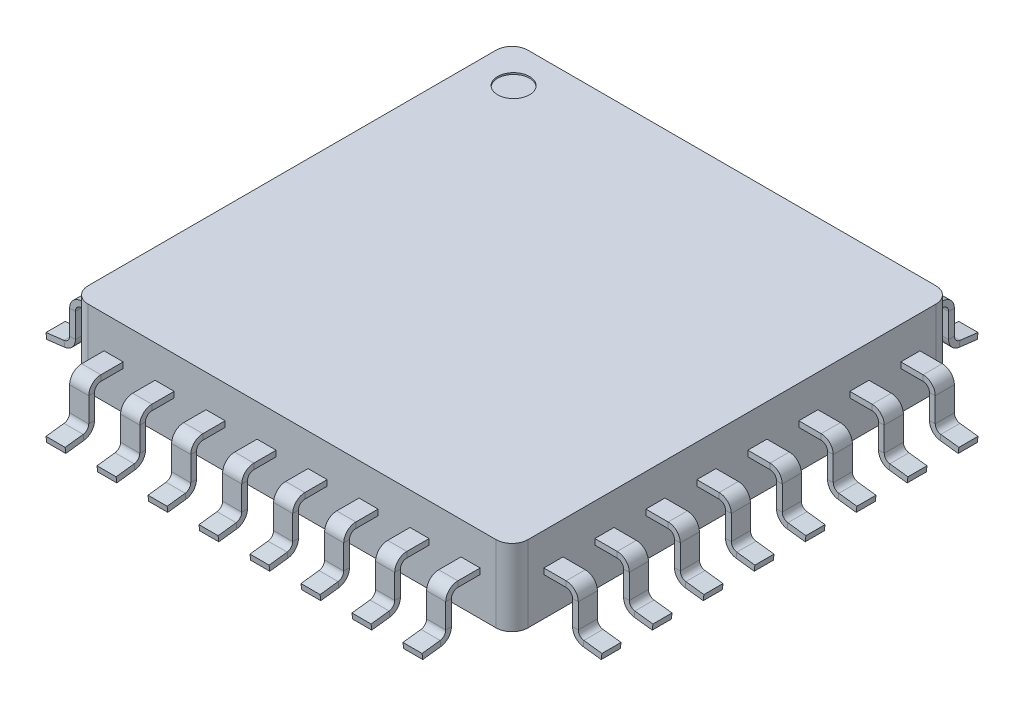
from build123d import *

# Parameters (mm, degrees)
SKETCH1_W               = 6.9
SKETCH1_H               = 6.9
BOSS_EXTRUDE1_DEPTH     = 1.2
FILLET1_R               = 0.25
SKETCH2_R               = 0.25
CUT_EXTRUDE1_DEPTH      = 0.025
BASE_FLANGE1_DEPTH      = 0.15
BASE_FLANGE1_DEPTH_BACK = 0.15
LPATTERN1_COUNT         = 5
LPATTERN1_PITCH         = 0.8
LPATTERN1_2_COUNT       = 4
LPATTERN1_2_PITCH       = 0.8
BASE_FLANGE2_START      = -0.15
BASE_FLANGE2_DEPTH      = 0.3
LPATTERN2_COUNT         = 5
LPATTERN2_PITCH         = 0.8
LPATTERN2_2_COUNT       = 4
LPATTERN2_2_PITCH       = 0.8


# Read off the part's stored shape, not the designer's step: Base-Flange2
# Sheet-metal steps are written as plain solids
with BuildPart() as part:
    # Sketch1 → Boss-Extrude1 (new body)
    with BuildSketch(Plane(origin=(0, 0, 0), x_dir=(1, 0, 0), z_dir=(0, 1, 0))):
        Rectangle(SKETCH1_W, SKETCH1_H)
    extrude(amount=BOSS_EXTRUDE1_DEPTH)

    # Fillet1
    fillet1_edges = [part.edges().sort_by_distance(p)[0] for p in [
        (3.45, 0.6, 3.45),
        (-3.45, 0.6, 3.45),
        (-3.45, 0.6, -3.45),
        (3.45, 0.6, -3.45),
    ]]
    fillet(fillet1_edges, radius=FILLET1_R)

    # Sketch2 → Cut-Extrude1 (cut)
    with BuildSketch(Plane(origin=(0, 1.2, 0), x_dir=(1, 0, 0), z_dir=(0, 1, 0))):
        with Locations(Location((-2.830868185, 2.855763462, 0), (0, 0, 270))):
            Circle(SKETCH2_R)
    extrude(amount=-CUT_EXTRUDE1_DEPTH, mode=Mode.SUBTRACT)


with BuildPart() as body_2:
    # Sketch3 → Base-Flange1 (new, two sides: drawn at the far end of the back side and taken through both)
    with BuildSketch(Plane.XY.offset(-0.4).offset(-BASE_FLANGE1_DEPTH_BACK)):
        with BuildLine():
            Line((-3.45, 0.6), (-3.8, 0.6))
            ThreePointArc((-3.8, 0.6), (-3.870710678, 0.570710678), (-3.9, 0.5))
            Line((-3.9, 0.5), (-3.9, 0.1180978))
            ThreePointArc((-3.9, 0.1180978), (-3.947698413, -0.007800009), (-4.066844825, -0.070485969))
            Line((-4.066844825, -0.070485969), (-4.35, -0.105253052))
            Line((-4.35, -0.105253052), (-4.360968241, -0.015923899))
            Line((-4.360968241, -0.015923899), (-4.077813066, 0.018843185))
            ThreePointArc((-4.077813066, 0.018843185), (-4.015104428, 0.051835795), (-3.99, 0.1180978))
            Line((-3.99, 0.1180978), (-3.99, 0.5))
            ThreePointArc((-3.99, 0.5), (-3.934350288, 0.634350288), (-3.8, 0.69))
            Line((-3.8, 0.69), (-3.45, 0.69))
            Line((-3.45, 0.69), (-3.45, 0.6))
        make_face()
    extrude(amount=BASE_FLANGE1_DEPTH + BASE_FLANGE1_DEPTH_BACK)


with BuildPart() as lpattern1_1:
    # LPattern1: pattern copy
    add(body_2.part.moved(Location(Vector(0, 0, 1) * (1 * LPATTERN1_PITCH))))


with BuildPart() as lpattern1_2:
    # LPattern1: pattern copy
    add(body_2.part.moved(Location(Vector(0, 0, 1) * (2 * LPATTERN1_PITCH))))


with BuildPart() as lpattern1_3:
    # LPattern1: pattern copy
    add(body_2.part.moved(Location(Vector(0, 0, 1) * (3 * LPATTERN1_PITCH))))


with BuildPart() as lpattern1_4:
    # LPattern1: pattern copy
    add(body_2.part.moved(Location(Vector(0, 0, 1) * (4 * LPATTERN1_PITCH))))


with BuildPart() as lpattern1_2_1:
    # LPattern1 2: pattern copy
    add(body_2.part.moved(Location(Vector(0, 0, -1) * (1 * LPATTERN1_2_PITCH))))


with BuildPart() as lpattern1_2_2:
    # LPattern1 2: pattern copy
    add(body_2.part.moved(Location(Vector(0, 0, -1) * (2 * LPATTERN1_2_PITCH))))


with BuildPart() as lpattern1_2_3:
    # LPattern1 2: pattern copy
    add(body_2.part.moved(Location(Vector(0, 0, -1) * (3 * LPATTERN1_2_PITCH))))


with BuildPart() as body_10:
    # Mirror1: mirrored copy
    add(body_2.part.mirror(Plane.ZY))


with BuildPart() as body_11:
    # Mirror1 2: mirrored copy
    add(lpattern1_1.part.mirror(Plane.ZY))


with BuildPart() as body_12:
    # Mirror1 3: mirrored copy
    add(lpattern1_2.part.mirror(Plane.ZY))


with BuildPart() as body_13:
    # Mirror1 4: mirrored copy
    add(lpattern1_3.part.mirror(Plane.ZY))


with BuildPart() as body_14:
    # Mirror1 5: mirrored copy
    add(lpattern1_4.part.mirror(Plane.ZY))


with BuildPart() as body_15:
    # Mirror1 6: mirrored copy
    add(lpattern1_2_1.part.mirror(Plane.ZY))


with BuildPart() as body_16:
    # Mirror1 7: mirrored copy
    add(lpattern1_2_2.part.mirror(Plane.ZY))


with BuildPart() as body_17:
    # Mirror1 8: mirrored copy
    add(lpattern1_2_3.part.mirror(Plane.ZY))


with BuildPart() as body_18:
    # Base-Flange2 outline → Base-Flange2 (new body)
    with BuildSketch(Plane.ZY.offset(-0.4).offset(BASE_FLANGE2_START)):
        with BuildLine():
            Line((-4.077813066, 0.018843185), (-4.360968241, -0.015923899))
            Line((-4.360968241, -0.015923899), (-4.35, -0.105253052))
            Line((-4.35, -0.105253052), (-4.066844825, -0.070485969))
            ThreePointArc((-4.066844825, -0.070485969), (-3.947698413, -0.007800009), (-3.9, 0.1180978))
            Line((-3.9, 0.1180978), (-3.9, 0.5))
            ThreePointArc((-3.9, 0.5), (-3.870710678, 0.570710678), (-3.8, 0.6))
            Line((-3.8, 0.6), (-3.45, 0.6))
            Line((-3.45, 0.6), (-3.45, 0.69))
            Line((-3.45, 0.69), (-3.8, 0.69))
            ThreePointArc((-3.8, 0.69), (-3.934350288, 0.634350288), (-3.99, 0.5))
            Line((-3.99, 0.5), (-3.99, 0.1180978))
            ThreePointArc((-3.99, 0.1180978), (-4.015104428, 0.051835795), (-4.077813066, 0.018843185))
        make_face()
    extrude(amount=BASE_FLANGE2_DEPTH)


with BuildPart() as lpattern2_1:
    # LPattern2: pattern copy
    add(body_18.part.moved(Location(Vector(-1, 0, 0) * (1 * LPATTERN2_PITCH))))


with BuildPart() as lpattern2_2:
    # LPattern2: pattern copy
    add(body_18.part.moved(Location(Vector(-1, 0, 0) * (2 * LPATTERN2_PITCH))))


with BuildPart() as lpattern2_3:
    # LPattern2: pattern copy
    add(body_18.part.moved(Location(Vector(-1, 0, 0) * (3 * LPATTERN2_PITCH))))


with BuildPart() as lpattern2_4:
    # LPattern2: pattern copy
    add(body_18.part.moved(Location(Vector(-1, 0, 0) * (4 * LPATTERN2_PITCH))))


with BuildPart() as lpattern2_2_1:
    # LPattern2 2: pattern copy
    add(body_18.part.moved(Location(Vector(1, 0, 0) * (1 * LPATTERN2_2_PITCH))))


with BuildPart() as lpattern2_2_2:
    # LPattern2 2: pattern copy
    add(body_18.part.moved(Location(Vector(1, 0, 0) * (2 * LPATTERN2_2_PITCH))))


with BuildPart() as lpattern2_2_3:
    # LPattern2 2: pattern copy
    add(body_18.part.moved(Location(Vector(1, 0, 0) * (3 * LPATTERN2_2_PITCH))))


with BuildPart() as body_26:
    # Mirror2: mirrored copy
    add(body_18.part.mirror(Plane.XY))


with BuildPart() as body_27:
    # Mirror2 2: mirrored copy
    add(lpattern2_2_1.part.mirror(Plane.XY))


with BuildPart() as body_28:
    # Mirror2 3: mirrored copy
    add(lpattern2_2_2.part.mirror(Plane.XY))


with BuildPart() as body_29:
    # Mirror2 4: mirrored copy
    add(lpattern2_2_3.part.mirror(Plane.XY))


with BuildPart() as body_30:
    # Mirror2 5: mirrored copy
    add(lpattern2_1.part.mirror(Plane.XY))


with BuildPart() as body_31:
    # Mirror2 6: mirrored copy
    add(lpattern2_2.part.mirror(Plane.XY))


with BuildPart() as body_32:
    # Mirror2 7: mirrored copy
    add(lpattern2_3.part.mirror(Plane.XY))


with BuildPart() as body_33:
    # Mirror2 8: mirrored copy
    add(lpattern2_4.part.mirror(Plane.XY))


solid = Compound([part.part, body_2.part, lpattern1_1.part, lpattern1_2.part, lpattern1_3.part, lpattern1_4.part, lpattern1_2_1.part, lpattern1_2_2.part, lpattern1_2_3.part, body_10.part, body_11.part, body_12.part, body_13.part, body_14.part, body_15.part, body_16.part, body_17.part, body_18.part, lpattern2_1.part, lpattern2_2.part, lpattern2_3.part, lpattern2_4.part, lpattern2_2_1.part, lpattern2_2_2.part, lpattern2_2_3.part, body_26.part, body_27.part, body_28.part, body_29.part, body_30.part, body_31.part, body_32.part, body_33.part])
